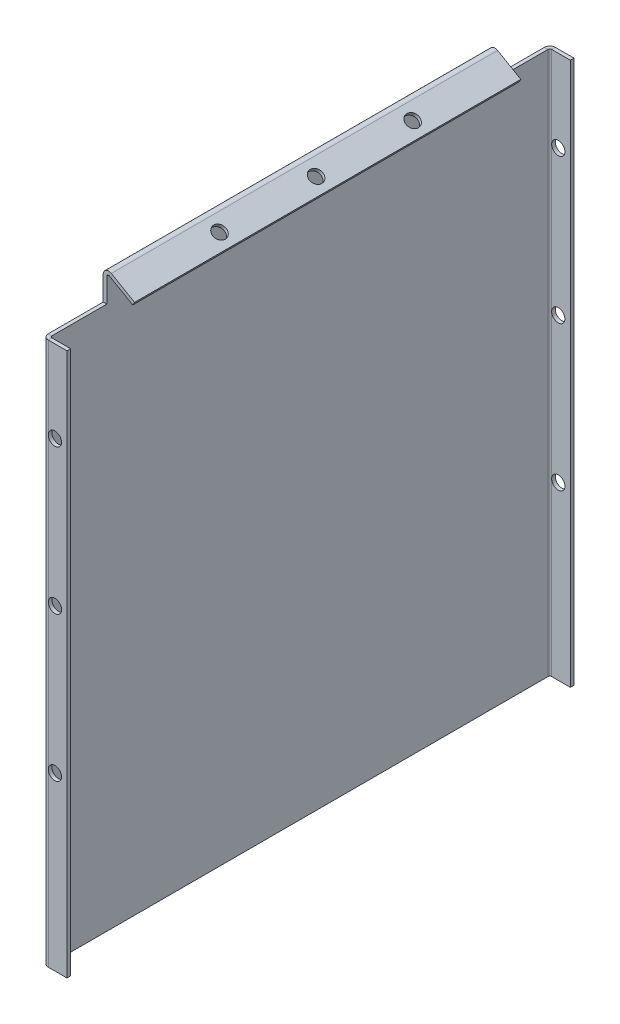
from build123d import *

# Parameters (mm, degrees)
SKETCH_1_W                       = 1.5
SKETCH_1_H                       = 200
SM_BASE_FLANGE_1_DEPTH           = 210
SM_EDGE_FLANGE_2_DEPTH           = 210
SM_EDGE_FLANGE_2_2_DEPTH         = 210
CUT_EXTRUDE_1_DEPTH              = 25
SKETCH_13_W                      = 1.5
SKETCH_13_H                      = 25
CUT_EXTRUDE_2_DEPTH              = 10
SKETCH_14_R                      = 2.75
CUT_EXTRUDE_3_DEPTH              = 10
SM_EDGE_FLANGE_5_STRIP_W         = 7.4732
SM_EDGE_FLANGE_5_STRIP_H         = 1.5
SM_EDGE_FLANGE_5_STRIP_CUT_DEPTH = 186.992120568
SM_EDGE_FLANGE_5_DEPTH           = 186.992120568
SM_EDGE_FLANGE_6_STRIP_W         = 7.4732
SM_EDGE_FLANGE_6_STRIP_H         = 1.5
SM_EDGE_FLANGE_6_STRIP_CUT_DEPTH = 186.992120568
SM_EDGE_FLANGE_6_DEPTH           = 186.992120568
SKETCH_27_R                      = 2.75
CUT_EXTRUDE_4_DEPTH              = 290.759957722
EXTRUDE_1_DEPTH                  = 38


# Read off the part's stored shape, not the designer's step: 边线-法兰2
# Sheet-metal steps are written as plain solids
with BuildPart() as part:
    # Sketch 1 → 基体-法兰1 (new body)
    with BuildSketch(Plane.XY):
        with Locations((0.75, 100)):
            Rectangle(SKETCH_1_W, SKETCH_1_H)
    extrude(amount=SM_BASE_FLANGE_1_DEPTH)

    # 边线-法兰2 outline → 边线-法兰2 (cut)
    with BuildSketch(Plane.XY):
        with BuildLine():
            ThreePointArc((0, 196.992120568), (0.413161062, 198.28728465), (1.5, 199.103944424))
            Line((1.5, 199.103944424), (1.5, 200))
            Line((1.5, 200), (0, 200))
            Line((0, 200), (0, 196.992120568))
        make_face()
    extrude(amount=SM_EDGE_FLANGE_2_DEPTH, mode=Mode.SUBTRACT)

    # Sm Edge Flange 2 2 outline → Sm Edge Flange 2 2 (add)
    with BuildSketch(Plane.XY):
        with BuildLine():
            Line((12.990381057, 193.366025404), (3.3549, 198.929072986))
            ThreePointArc((3.3549, 198.929072986), (2.446525528, 199.218847051), (1.5, 199.103944424))
            Line((1.5, 199.103944424), (1.5, 196.992120568))
            ThreePointArc((1.5, 196.992120568), (1.8683, 197.63003488), (2.6049, 197.63003488))
            Line((2.6049, 197.63003488), (12.240381057, 192.066987298))
            Line((12.240381057, 192.066987298), (12.990381057, 193.366025404))
        make_face()
    extrude(amount=SM_EDGE_FLANGE_2_2_DEPTH)

    # 草图12 → 切除-拉伸1 (cut)
    with BuildSketch(Plane(origin=(0, 0, 0), x_dir=(-1, 0, 0), z_dir=(0, 0, -1))):
        Polygon((0, 196.992120568), (-3.169381215, 196.992120568), (-3.169381215, 190.456162681), (-17.36722667, 190.456162681), (-17.36722667, 200.115352772), (-3.169381215, 200.115352772), (0, 200.115352772), align=None)
    cut_extrude_1 = extrude(amount=-CUT_EXTRUDE_1_DEPTH, mode=Mode.SUBTRACT)

    # 草图13 → 切除-拉伸2 (cut)
    with BuildSketch(Plane(origin=(0, 196.992120568, 0), x_dir=(1, 0, 0), z_dir=(0, 1, 0))):
        with Locations((0.75, -12.5)):
            Rectangle(SKETCH_13_W, SKETCH_13_H)
    cut_extrude_2 = extrude(amount=-CUT_EXTRUDE_2_DEPTH, mode=Mode.SUBTRACT)

    # 镜向1: 切除-拉伸1, 切除-拉伸2 across plane
    add(cut_extrude_1.mirror(Plane(origin=(0, 0, 105), x_dir=(1, 0, 0), z_dir=(0, 0, -1))), mode=Mode.SUBTRACT)
    add(cut_extrude_2.mirror(Plane(origin=(0, 0, 105), x_dir=(1, 0, 0), z_dir=(0, 0, -1))), mode=Mode.SUBTRACT)

    # 草图14 → 切除-拉伸3 (cut)
    with BuildSketch(Plane(origin=(86.227540378, 149.350480947, 0), x_dir=(0.86602540378444, -0.4999999999999978, 0), z_dir=(-0.4999999999999978, -0.86602540378444, 0))):
        with Locations((-90.996060284, 65)):
            Circle(SKETCH_14_R)
        with Locations((-90.996060284, 105)):
            Circle(SKETCH_14_R)
        with Locations(Location((-90.996060284, 145, 0), (0, 0, 180))):
            Circle(SKETCH_14_R)
    extrude(amount=-CUT_EXTRUDE_3_DEPTH, mode=Mode.SUBTRACT)

    # 边线-法兰5 strip (across the edge) → 边线-法兰5 strip cut (cut)
    with BuildSketch(Plane(origin=(1.5, 0, 0), x_dir=(0, 0, 1), z_dir=(0, 1, 0))):
        with Locations((-1.5, -0.75)):
            Rectangle(SM_EDGE_FLANGE_5_STRIP_W, SM_EDGE_FLANGE_5_STRIP_H)
    extrude(amount=SM_EDGE_FLANGE_5_STRIP_CUT_DEPTH, mode=Mode.SUBTRACT)

    # 边线-法兰5 section (across the edge) → 边线-法兰5 (add)
    with BuildSketch(Plane(origin=(1.5, 0, 0), x_dir=(0, 0, 1), z_dir=(0, 1, 0))):
        with BuildLine():
            Line((0, 0.7366), (0, 8.5))
            Line((0, 8.5), (1.5, 8.5))
            Line((1.5, 8.5), (1.5, 0.7366))
            ThreePointArc((1.5, 0.7366), (1.715745145, 0.215745145), (2.2366, 0))
            Line((2.2366, 0), (2.2366, -1.5))
            ThreePointArc((2.2366, -1.5), (0.655084973, -0.844915027), (0, 0.7366))
        make_face()
    extrude(amount=SM_EDGE_FLANGE_5_DEPTH)

    # 边线-法兰6 strip (across the edge) → 边线-法兰6 strip cut (cut)
    with BuildSketch(Plane(origin=(1.5, 186.992120568, 210), x_dir=(0, 0, -1), z_dir=(0, -1, 0))):
        with Locations((-1.5, -0.75)):
            Rectangle(SM_EDGE_FLANGE_6_STRIP_W, SM_EDGE_FLANGE_6_STRIP_H)
    extrude(amount=SM_EDGE_FLANGE_6_STRIP_CUT_DEPTH, mode=Mode.SUBTRACT)

    # 边线-法兰6 section (across the edge) → 边线-法兰6 (add)
    with BuildSketch(Plane(origin=(1.5, 186.992120568, 210), x_dir=(0, 0, -1), z_dir=(0, -1, 0))):
        with BuildLine():
            Line((0, 0.7366), (0, 8.5))
            Line((0, 8.5), (1.5, 8.5))
            Line((1.5, 8.5), (1.5, 0.7366))
            ThreePointArc((1.5, 0.7366), (1.715745145, 0.215745145), (2.2366, 0))
            Line((2.2366, 0), (2.2366, -1.5))
            ThreePointArc((2.2366, -1.5), (0.655084973, -0.844915027), (0, 0.7366))
        make_face()
    extrude(amount=SM_EDGE_FLANGE_6_DEPTH)

    # 草图27 → 切除-拉伸4 (cut, through all)
    with BuildSketch(Plane(origin=(0, 0, 0), x_dir=(-1, 0, 0), z_dir=(0, 0, -1))):
        with Locations((-5, 153)):
            Circle(SKETCH_27_R)
        with Locations((-5, 93)):
            Circle(SKETCH_27_R)
        with Locations((-5, 33)):
            Circle(SKETCH_27_R)
    extrude(amount=-CUT_EXTRUDE_4_DEPTH, mode=Mode.SUBTRACT)

    # 草图28 → 凸台-拉伸1 (add)
    with BuildSketch(Plane.XZ):
        with BuildLine():
            Line((0, 2.2366), (0, 207.7634))
            ThreePointArc((0, 207.7634), (0.655084973, 209.344915027), (2.2366, 210))
            Line((2.2366, 210), (10, 210))
            Line((10, 210), (10, 208.5))
            Line((10, 208.5), (2.2366, 208.5))
            ThreePointArc((2.2366, 208.5), (1.715745145, 208.284254855), (1.5, 207.7634))
            Line((1.5, 207.7634), (1.5, 2.2366))
            ThreePointArc((1.5, 2.2366), (1.715745145, 1.715745145), (2.2366, 1.5))
            Line((2.2366, 1.5), (10, 1.5))
            Line((10, 1.5), (10, 0))
            Line((10, 0), (2.2366, 0))
            ThreePointArc((2.2366, 0), (0.655084973, 0.655084973), (0, 2.2366))
        make_face()
    extrude(amount=EXTRUDE_1_DEPTH)


solid = part.part
